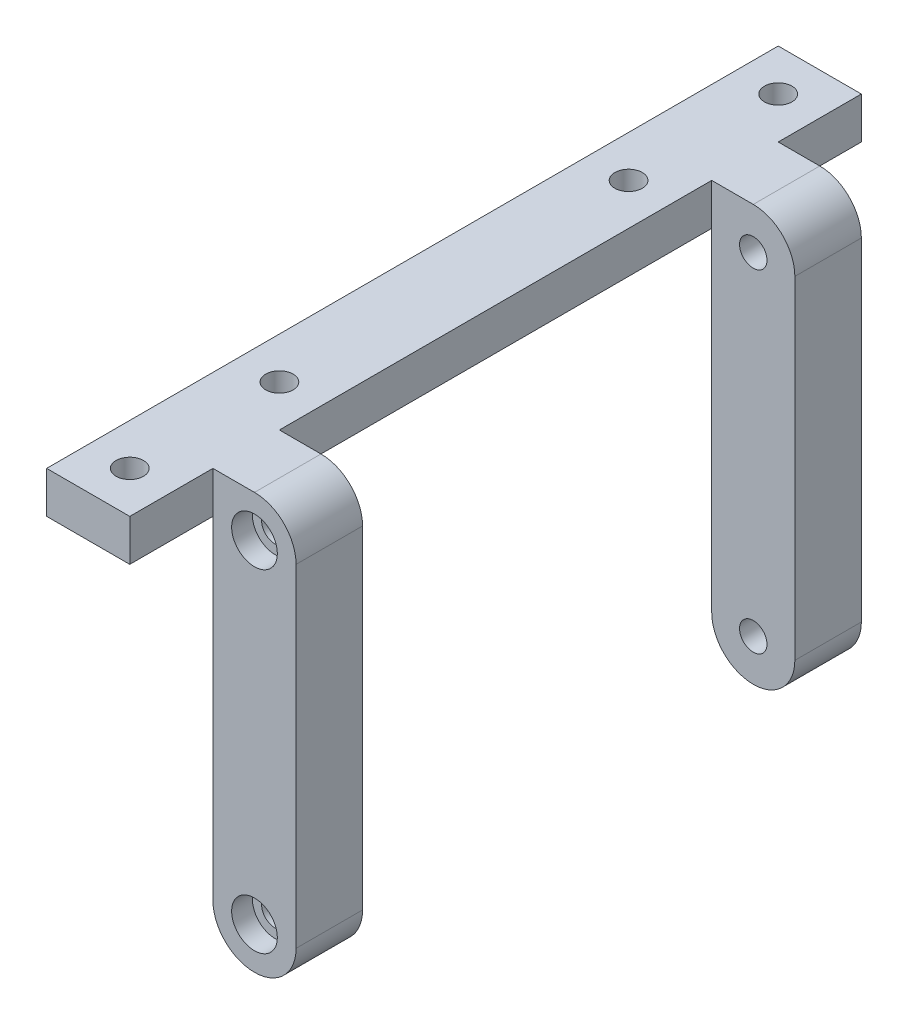
from build123d import *

# Parameters (mm, degrees)
P_IDAT_VYSUNUT_M1_DEPTH  = 8
SKICA2_R                 = 1.65
ODEBRAT_VYSUNUT_M1_DEPTH = 47.786750261
P_IDAT_VYSUNUT_M2_DEPTH  = 5
SKICA4_R                 = 1.65
ODEBRAT_VYSUNUT_M2_DEPTH = 5
SKICA5_R                 = 1.65
ODEBRAT_VYSUNUT_M3_DEPTH = 55.074023338
ZAOBLIT1_R               = 5
SKICA6_W                 = 2
SKICA6_H                 = 23
P_IDAT_VYSUNUT_M3_DEPTH  = 8
SKICA7_R                 = 2.75
ODEBRAT_VYSUNUT_M4_DEPTH = 2.5
SKICA8_W                 = 10
SKICA8_H                 = 5
P_IDAT_VYSUNUT_M4_DEPTH  = 60
SKICA9_W                 = 8
SKICA9_H                 = 5
P_IDAT_VYSUNUT_M5_DEPTH  = 10
SKICA10_W                = 10
SKICA10_H                = 8
P_IDAT_VYSUNUT_M6_DEPTH  = 45
ZAOBLIT2_R               = 5
SKICA11_R                = 1.65
ODEBRAT_VYSUNUT_M5_DEPTH = 45
ODEBRAT_START            = -2.5
SKICA12_R                = 2.75
ODEBRAT_VYSUNUT_M6_DEPTH = 2.5
SKICA13_R                = 1.65
ODEBRAT_VYSUNUT_M7_DEPTH = 12.5


with BuildPart() as part:
    # Skica1 → Přidat vysunutím1 (new body)
    with BuildSketch(Plane.XY):
        Polygon((0, 0), (10, 0), (10, 10), (8, 10), (8, 33), (10, 33), (10, 45), (0, 45), align=None)
    extrude(amount=P_IDAT_VYSUNUT_M1_DEPTH)

    # Skica2 → Odebrat vysunutím1 (cut, through all)
    with BuildSketch(Plane.XY.offset(8)):
        with Locations((5, 45)):
            Circle(SKICA2_R)
        with Locations((5, 5)):
            Circle(SKICA2_R)
    extrude(amount=-ODEBRAT_VYSUNUT_M1_DEPTH, mode=Mode.SUBTRACT)

    # Skica3 → Přidat vysunutím2 (add)
    with BuildSketch(Plane(origin=(0, 45, 0), x_dir=(1, 0, 0), z_dir=(0, 1, 0))):
        Polygon((0, 0), (0, 10), (-10, 10), (-10, -18), (0, -18), (0, -8), (10, -8), (10, 0), align=None)
    extrude(amount=P_IDAT_VYSUNUT_M2_DEPTH)

    # Skica4 → Odebrat vysunutím2 (cut)
    with BuildSketch(Plane(origin=(0, 50, 0), x_dir=(1, 0, 0), z_dir=(0, 1, 0))):
        with Locations(Location((-5, 5, 0), (0, 0, 270))):
            Circle(SKICA4_R)
        with Locations(Location((-5, -13, 0), (0, 0, 270))):
            Circle(SKICA4_R)
    extrude(amount=-ODEBRAT_VYSUNUT_M2_DEPTH, mode=Mode.SUBTRACT)

    # Skica5 → Odebrat vysunutím3 (cut, through all)
    with BuildSketch(Plane.XY.offset(8)):
        with Locations((5, 45)):
            Circle(SKICA5_R)
    extrude(amount=-ODEBRAT_VYSUNUT_M3_DEPTH, mode=Mode.SUBTRACT)

    # Zaoblit1
    zaoblit1_edges = [part.edges().sort_by_distance(p)[0] for p in [
        (0, 0, 4),
        (10, 0, 4),
        (10, 50, 4),
    ]]
    fillet(zaoblit1_edges, radius=ZAOBLIT1_R - 0.0001)  # a hair under: the kernel refuses the full size

    # Skica6 → Přidat vysunutím3 (add)
    with BuildSketch(Plane.XY.offset(8)):
        with Locations((9, 21.5)):
            Rectangle(SKICA6_W, SKICA6_H)
    extrude(amount=-P_IDAT_VYSUNUT_M3_DEPTH)

    # Skica7 → Odebrat vysunutím4 (cut)
    with BuildSketch(Plane.XY.offset(8)):
        with Locations((5, 5)):
            Circle(SKICA7_R)
        with Locations((5, 45)):
            Circle(SKICA7_R)
    extrude(amount=-ODEBRAT_VYSUNUT_M4_DEPTH, mode=Mode.SUBTRACT)

    # Skica8 → Přidat vysunutím4 (add)
    with BuildSketch(Plane(origin=(0, 0, -10), x_dir=(-1, 0, 0), z_dir=(0, 0, -1))):
        with Locations((5, 47.5)):
            Rectangle(SKICA8_W, SKICA8_H)
    extrude(amount=P_IDAT_VYSUNUT_M4_DEPTH)

    # Skica9 → Přidat vysunutím5 (add)
    with BuildSketch(Plane(origin=(0, 0, 0), x_dir=(0, 0, -1), z_dir=(1, 0, 0))):
        with Locations((56, 47.5)):
            Rectangle(SKICA9_W, SKICA9_H)
    extrude(amount=P_IDAT_VYSUNUT_M5_DEPTH)

    # Skica10 → Přidat vysunutím6 (add)
    with BuildSketch(Plane.XZ.offset(-45)):
        with Locations((5, -56)):
            Rectangle(SKICA10_W, SKICA10_H)
    extrude(amount=P_IDAT_VYSUNUT_M6_DEPTH)

    # Zaoblit2
    zaoblit2_edges = [part.edges().sort_by_distance(p)[0] for p in [
        (10, 50, -56),
        (10, 0, -56),
        (0, 0, -56),
    ]]
    fillet(zaoblit2_edges, radius=ZAOBLIT2_R - 0.0001)  # a hair under: the kernel refuses the full size

    # Skica11 → Odebrat vysunutím5 (cut)
    with BuildSketch(Plane.XY.offset(-52)):
        with Locations((5, 45)):
            Circle(SKICA11_R)
        with Locations((5, 5)):
            Circle(SKICA11_R)
    extrude(amount=-ODEBRAT_VYSUNUT_M5_DEPTH, mode=Mode.SUBTRACT)

    # Skica12 → Odebrat vysunutím6 (cut)
    with BuildSketch(Plane(origin=(0, 0, -60), x_dir=(-1, 0, 0), z_dir=(0, 0, -1)).offset(ODEBRAT_START)):
        with Locations(Location((-5, 45, 0), (0, 0, 180))):
            Circle(SKICA12_R)
        with Locations(Location((-5, 5, 0), (0, 0, 180))):
            Circle(SKICA12_R)
    extrude(amount=ODEBRAT_VYSUNUT_M6_DEPTH, mode=Mode.SUBTRACT)

    # Skica13 → Odebrat vysunutím7 (cut)
    with BuildSketch(Plane(origin=(0, 50, 0), x_dir=(1, 0, 0), z_dir=(0, 1, 0))):
        with Locations(Location((-5, 65, 0), (0, 0, 270))):
            Circle(SKICA13_R)
        with Locations(Location((-5, 47, 0), (0, 0, 270))):
            Circle(SKICA13_R)
    extrude(amount=-ODEBRAT_VYSUNUT_M7_DEPTH, mode=Mode.SUBTRACT)


solid = part.part
